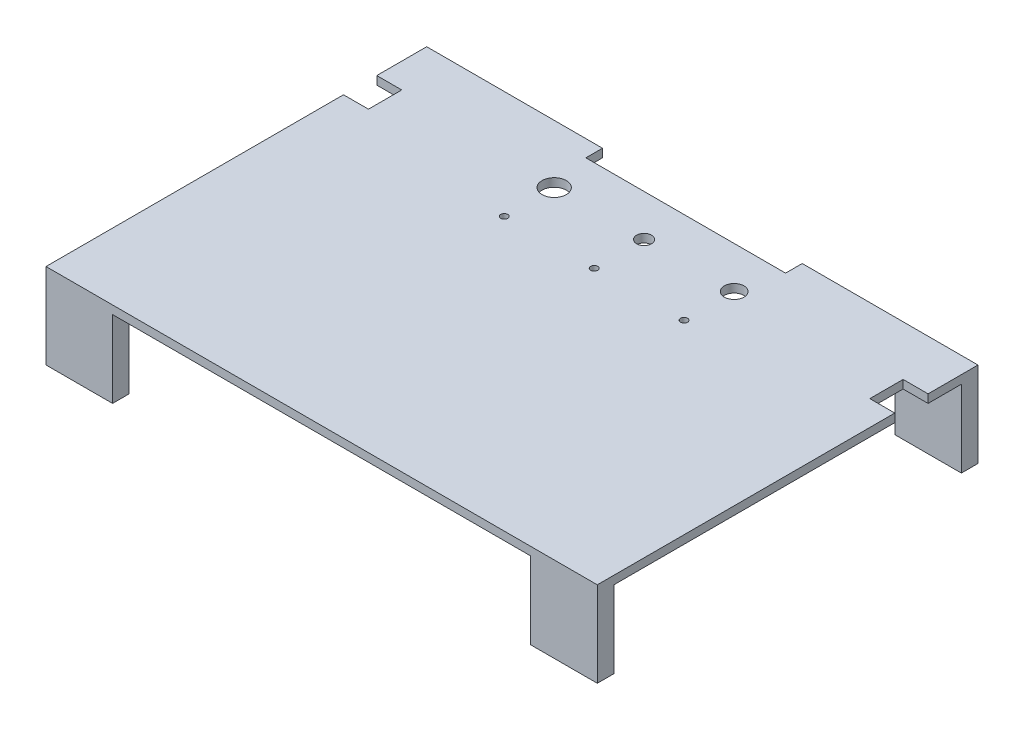
from build123d import *

# Parameters (mm, degrees)
SKETCH1_W                   = 420.6875
SKETCH1_H                   = 290.5125
DESKTOP_DEPTH               = 6.35
SKETCH2_W                   = 19.05
SKETCH2_H                   = 25.4
BRIEF_CASE_ARM_CUTOUT_DEPTH = 6.35
SKETCH5_W                   = 152.4
SKETCH5_H                   = 12.7
HDMI_SCREEN_CUTOUT_DEPTH    = 16.51
SKETCH8_R                   = 7.493
SKETCH8_R_2                 = 9.271
SKETCH8_R_3                 = 5.715
SKETCH8_R_4                 = 2.667
SWITCHES_AND_LIGHTS_DEPTH   = 16.51
LEGS_DEPTH                  = 58.7375
LEGS_2_0_DEPTH              = 58.7375


with BuildPart() as part:
    # Sketch1 → Desktop (new body)
    with BuildSketch(Plane(origin=(0, 0, 0), x_dir=(1, 0, 0), z_dir=(0, 1, 0))):
        Rectangle(SKETCH1_W, SKETCH1_H)
    extrude(amount=DESKTOP_DEPTH)

    # Sketch2 → Brief Case Arm Cutout (cut)
    with BuildSketch(Plane(origin=(0, 6.35, 0), x_dir=(1, 0, 0), z_dir=(0, 1, 0))):
        with Locations((200.81875, 94.45625)):
            Rectangle(SKETCH2_W, SKETCH2_H)
        with Locations((-200.81875, 94.45625)):
            Rectangle(SKETCH2_W, SKETCH2_H)
    extrude(amount=-BRIEF_CASE_ARM_CUTOUT_DEPTH, mode=Mode.SUBTRACT)

    # Sketch5 → HDMI Screen Cutout (cut)
    with BuildSketch(Plane(origin=(0, 6.35, 0), x_dir=(1, 0, 0), z_dir=(0, 1, 0))):
        with Locations((0, 138.90625)):
            Rectangle(SKETCH5_W, SKETCH5_H)
    extrude(amount=-HDMI_SCREEN_CUTOUT_DEPTH, mode=Mode.SUBTRACT)

    # Sketch8 → Switches and Lights (cut)
    with BuildSketch(Plane(origin=(0, 6.35, 0), x_dir=(1, 0, 0), z_dir=(0, 1, 0))):
        with Locations((68.73875, 100.80625)):
            Circle(SKETCH8_R)
        with Locations((-68.61175, 100.80625)):
            Circle(SKETCH8_R_2)
        with Locations((0, 100.80625)):
            Circle(SKETCH8_R_3)
        with Locations((-68.61175, 62.70625)):
            Circle(SKETCH8_R_4)
        with Locations((0, 62.70625)):
            Circle(SKETCH8_R_4)
        with Locations((68.61175, 62.70625)):
            Circle(SKETCH8_R_4)
    extrude(amount=-SWITCHES_AND_LIGHTS_DEPTH, mode=Mode.SUBTRACT)

    # Sketch10 → Legs (add)
    with BuildSketch(Plane.XZ):
        Polygon((-159.54375, 145.25625), (-210.34375, 145.25625), (-210.34375, 132.55625), (-197.64375, 132.55625), (-159.54375, 132.55625), align=None)
        Polygon((159.54375, -132.55625), (159.54375, -145.25625), (210.34375, -145.25625), (210.34375, -132.55625), (197.64375, -132.55625), align=None)
    extrude(amount=LEGS_DEPTH)

    # Sketch12 → Legs 2.0 (add)
    with BuildSketch(Plane.XZ):
        Polygon((159.54375, 145.25625), (210.34375, 145.25625), (210.34375, 132.55625), (197.64375, 132.55625), (159.54375, 132.55625), align=None)
        Polygon((-159.54375, -132.55625), (-159.54375, -145.25625), (-210.34375, -145.25625), (-210.34375, -132.55625), (-197.64375, -132.55625), align=None)
    extrude(amount=LEGS_2_0_DEPTH)


solid = part.part
